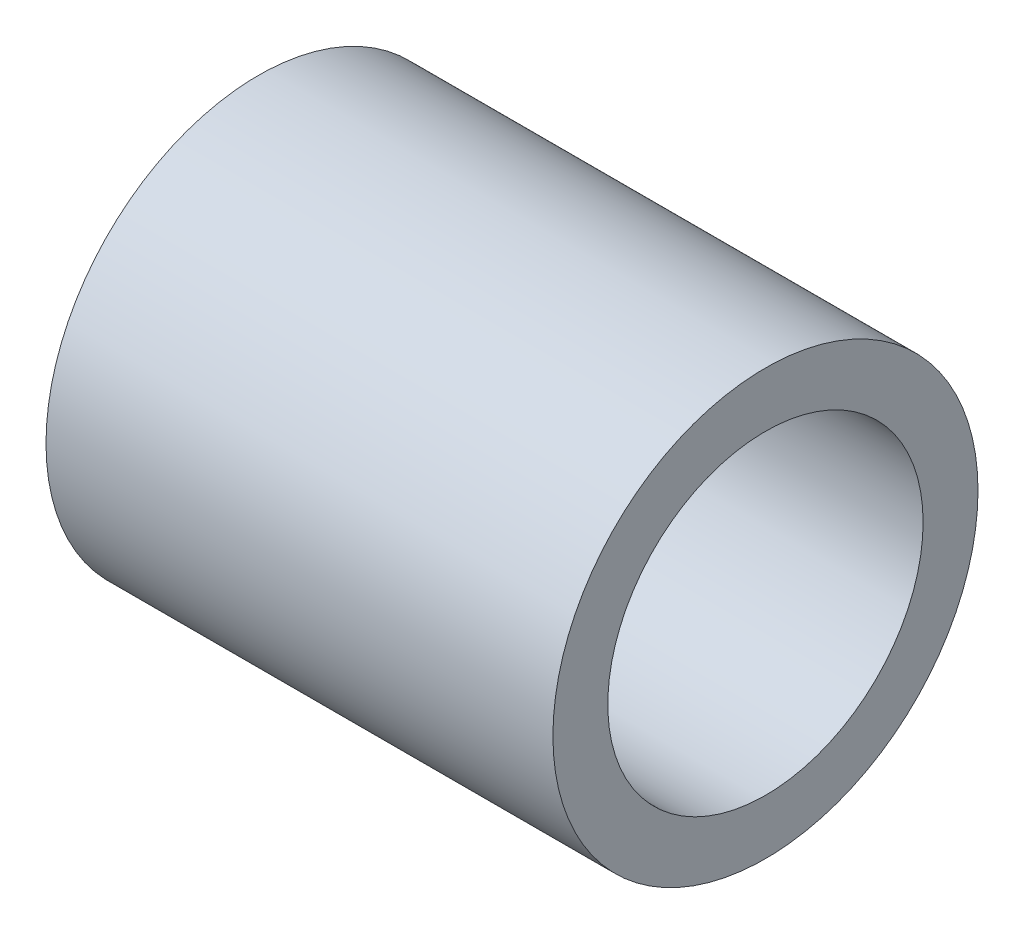
from build123d import *

# Parameters (mm, degrees)
CROQUIS1_R              = 10.65
CROQUIS1_R_2            = 7.9
SALIENTE_EXTRUIR1_DEPTH = 25.4


with BuildPart() as part:
    # Croquis1 → Saliente-Extruir1 (new body)
    with BuildSketch(Plane(origin=(0, 0, 0), x_dir=(0, 0, -1), z_dir=(1, 0, 0))):
        Circle(CROQUIS1_R)
        Circle(CROQUIS1_R_2, mode=Mode.SUBTRACT)
    extrude(amount=SALIENTE_EXTRUIR1_DEPTH)


solid = part.part
